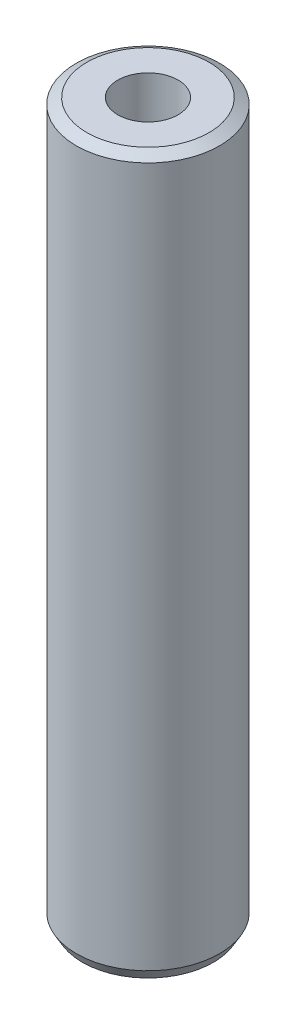
from build123d import *
from OCP.BRepFilletAPI import BRepFilletAPI_MakeChamfer

# Parameters (mm, degrees)
SKETCH1_R           = 60
BOSS_EXTRUDE1_DEPTH = 600
SKETCH2_R           = 25.259832391
CUT_EXTRUDE1_DEPTH  = 606.970296302
CHAMFER1_SIZE       = 5.117629192
CHAMFER1_SIZE2      = 8.863993774


with BuildPart() as part:
    # Sketch1 → Boss-Extrude1 (new body)
    with BuildSketch(Plane(origin=(0, 0, 0), x_dir=(1, 0, 0), z_dir=(0, 1, 0))):
        Circle(SKETCH1_R)
    extrude(amount=BOSS_EXTRUDE1_DEPTH)

    # Sketch2 → Cut-Extrude1 (cut, through all)
    with BuildSketch(Plane(origin=(0, 0, 0), x_dir=(1, 0, 0), z_dir=(0, 1, 0))):
        Circle(SKETCH2_R)
    extrude(amount=CUT_EXTRUDE1_DEPTH, mode=Mode.SUBTRACT)

    # Chamfer1: one chamfer whose edges measure the first distance from different faces: ONE call of the kernel's chamfer builder (chamfer() names one face for all edges)
    chamfer1_edges_1 = [part.edges().sort_by_distance(p)[0] for p in [
        (-60, 600, 0),
    ]]
    chamfer1_side_1 = [part.faces().sort_by_distance(p)[0] for p in [
        (-60, 300, 0),
    ]]
    chamfer1_edges_2 = [part.edges().sort_by_distance(p)[0] for p in [
        (-60, 0, 0),
    ]]
    chamfer1_side_2 = [part.faces().sort_by_distance(p)[0] for p in [
        (-58.302943725, 0, 0),
    ]]
    chamfer1 = BRepFilletAPI_MakeChamfer(part.part.solid().wrapped)
    for e in chamfer1_edges_1:
        chamfer1.Add(CHAMFER1_SIZE, CHAMFER1_SIZE2, e.wrapped, chamfer1_side_1[0].wrapped)  # the first distance lies on this face
    for e in chamfer1_edges_2:
        chamfer1.Add(CHAMFER1_SIZE, CHAMFER1_SIZE2, e.wrapped, chamfer1_side_2[0].wrapped)  # the first distance lies on this face
    add(Compound.cast(chamfer1.Shape()), mode=Mode.REPLACE)


solid = part.part
